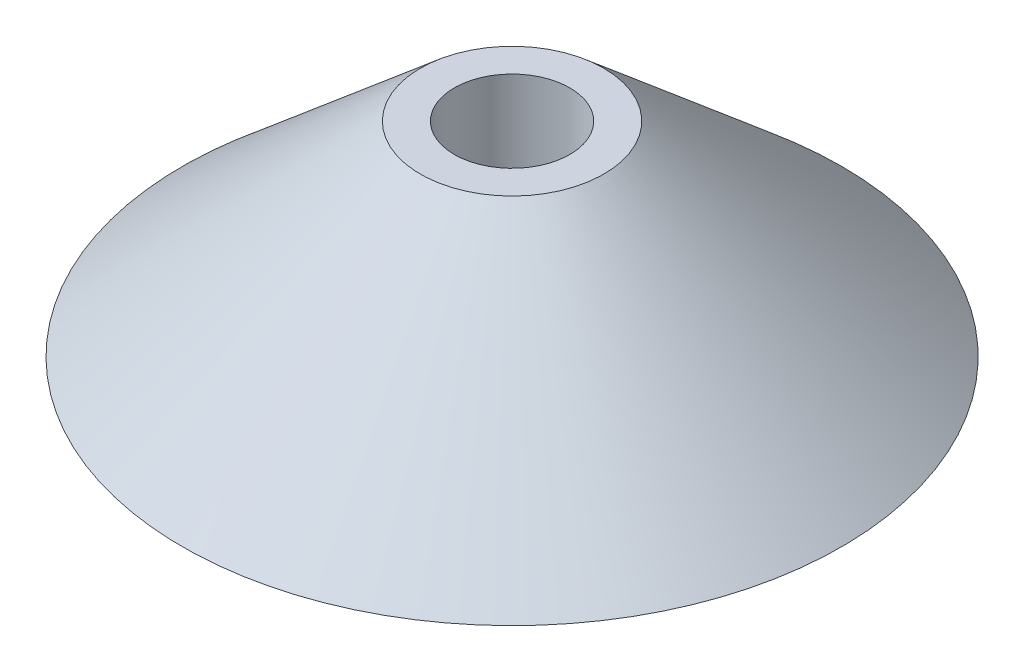
from build123d import *


with BuildPart() as part:
    # Sketch1 → Revolve1 (revolve)
    with BuildSketch(Plane.XY):
        Polygon((-2.7, 6), (-9.7, 0), (-1.7, 0), (-1.7, 6), align=None)
    revolve(axis=Axis((0, 11.326530612, 0), (0, -1, 0)))


solid = part.part
